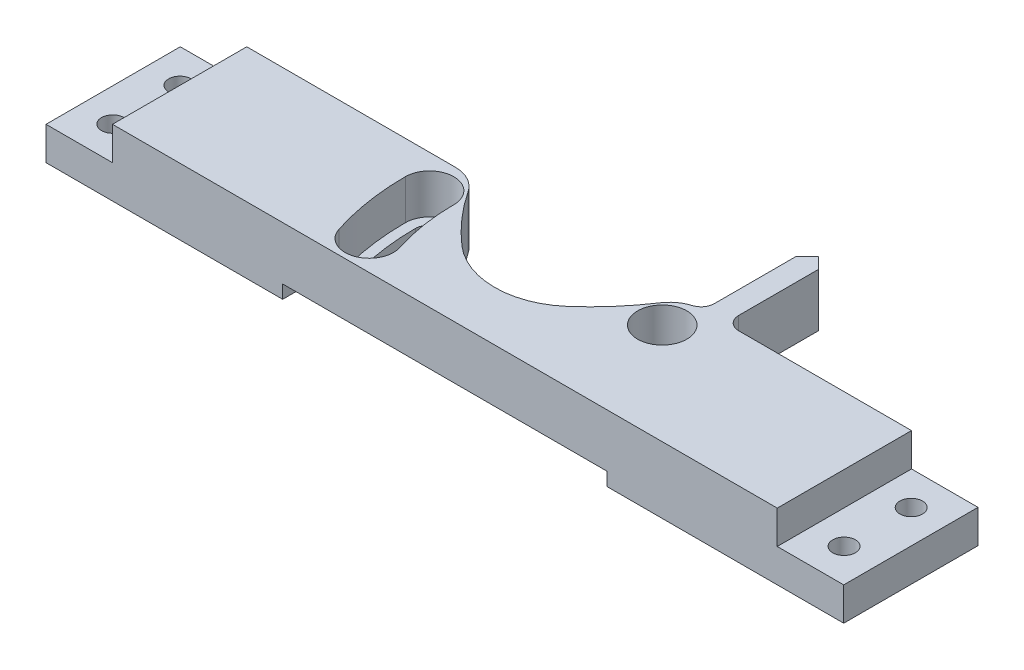
from build123d import *

# Parameters (mm, degrees)
AUFSATZ_LINEAR_AUSTRAGEN1_DEPTH  = 10
AUFSATZ_LINEAR_START             = 2
AUFSATZ_LINEAR_AUSTRAGEN2_DEPTH  = 2
SKIZZE3_R                        = 2.15
SCHNITT_LINEAR_AUSTRAGEN1_DEPTH  = 63.032572089
SKIZZE5_R                        = 3.7
SKIZZE5_R_2                      = 2.15
SCHNITT_LINEAR_AUSTRAGEN3_DEPTH  = 6
VERRUNDUNG3_START                = -11
VERRUNDUNG3_DEPTH                = 12
VERRUNDUNG3_START_2              = -10.2
VERRUNDUNG3_2_DEPTH              = 10.2
SKIZZE9_W                        = 10
SKIZZE9_H                        = 5
SCHNITT_LINEAR_AUSTRAGEN6_DEPTH  = 62.676900052
SKIZZE10_W                       = 10
SKIZZE10_H                       = 10
AUFSATZ_LINEAR_AUSTRAGEN3_DEPTH  = 5
AUFSATZ_LINEAR_AUSTRAGEN4_DEPTH  = 10
SKIZZE12_R                       = 1.7
SCHNITT_LINEAR_AUSTRAGEN7_DEPTH  = 62.262060037
SCHNITT_LINEAR_AUSTRAGEN8_DEPTH  = 63.032572089
SCHNITT_LINEAR_AUSTRAGEN10_DEPTH = 63.032572089
VERRUNDUNG6_R                    = 5
VERRUNDUNG7_R                    = 12
SCHNITT_LINEAR_AUSTRAGEN11_DEPTH = 6
SKIZZE19_W                       = 48.79312263
SKIZZE19_H                       = 28.151116142
SCHNITT_LINEAR_AUSTRAGEN12_DEPTH = 4
AUFSATZ_LINEAR_AUSTRAGEN6_DEPTH  = 8
VERRUNDUNG8_R                    = 2


with BuildPart() as part:
    # Skizze1 → Aufsatz-Linear austragen1 (new body)
    with BuildSketch(Plane(origin=(0, 0, 0), x_dir=(1, 0, 0), z_dir=(0, 1, 0))):
        with BuildLine():
            Line((-60, 0), (60, 0))
            Line((60, 0), (60, 10.2))
            Line((60, 10.2), (14.486956443, 10.2))
            ThreePointArc((14.486956443, 10.2), (7.840151577, 5.759336515), (0, 4.2))
            ThreePointArc((0, 4.2), (-7.840151577, 5.759336515), (-14.486956443, 10.2))
            Line((-14.486956443, 10.2), (-60, 10.2))
            Line((-60, 10.2), (-60, 0))
        make_face()
    extrude(amount=AUFSATZ_LINEAR_AUSTRAGEN1_DEPTH)

    # Skizze7 → Aufsatz-Linear austragen2 (add)
    with BuildSketch(Plane.XZ.offset(AUFSATZ_LINEAR_START)):
        with BuildLine():
            Line((23, 0), (23, -10.2))
            Line((23, -10.2), (14.486956443, -10.2))
            ThreePointArc((14.486956443, -10.2), (0, -4.2), (-14.486956443, -10.2))
            Line((-14.486956443, -10.2), (-23, -10.2))
            Line((-23, -10.2), (-23, 0))
            Line((-23, 0), (23, 0))
        make_face()
    extrude(amount=-AUFSATZ_LINEAR_AUSTRAGEN2_DEPTH)

    # Skizze3 → Schnitt-Linear austragen1 (cut, through all)
    with BuildSketch(Plane(origin=(0, 10, 0), x_dir=(1, 0, 0), z_dir=(0, 1, 0))):
        with Locations(Location((17.5, 5.2, 0), (0, 0, 270))):
            Circle(SKIZZE3_R)
    extrude(amount=-SCHNITT_LINEAR_AUSTRAGEN1_DEPTH, mode=Mode.SUBTRACT)

    # Skizze5 → Schnitt-Linear austragen3 (cut)
    with BuildSketch(Plane(origin=(0, 10, 0), x_dir=(1, 0, 0), z_dir=(0, 1, 0))):
        with Locations(Location((17.5, 5.2, 0), (0, 0, 270))):
            Circle(SKIZZE5_R)
        with Locations(Location((17.5, 5.2, 0), (0, 0, 270))):
            Circle(SKIZZE5_R_2, mode=Mode.SUBTRACT)
    extrude(amount=-SCHNITT_LINEAR_AUSTRAGEN3_DEPTH, mode=Mode.SUBTRACT)

    # Verrundung3: read off the stored shape, not the designer's step
    # Verrundung3 outline → Verrundung3 (cut)
    with BuildSketch(Plane.XY.offset(VERRUNDUNG3_START)):
        with BuildLine():
            ThreePointArc((23, -1), (22.707106781, -1.707106781), (22, -2))
            Line((22, -2), (23, -2))
            Line((23, -2), (23, -1))
        make_face()
        with BuildLine():
            ThreePointArc((-22, -2), (-22.707106781, -1.707106781), (-23, -1))
            Line((-23, -1), (-23, -2))
            Line((-23, -2), (-22, -2))
        make_face()
    extrude(amount=VERRUNDUNG3_DEPTH, mode=Mode.SUBTRACT)

    # Verrundung3 2 outline → Verrundung3 2 (add)
    with BuildSketch(Plane.XY.offset(VERRUNDUNG3_START_2)):
        with BuildLine():
            Line((-23, 0), (-24, 0))
            ThreePointArc((-24, 0), (-23.292893219, -0.292893219), (-23, -1))
            Line((-23, -1), (-23, 0))
        make_face()
        with BuildLine():
            Line((23, 0), (23, -1))
            ThreePointArc((23, -1), (23.292893219, -0.292893219), (24, 0))
            Line((24, 0), (23, 0))
        make_face()
    extrude(amount=VERRUNDUNG3_2_DEPTH)

    # Skizze9 → Schnitt-Linear austragen6 (cut, through all)
    with BuildSketch(Plane.XY):
        with Locations((-55, 7.5)):
            Rectangle(SKIZZE9_W, SKIZZE9_H)
        with Locations((55, 7.5)):
            Rectangle(SKIZZE9_W, SKIZZE9_H)
    extrude(amount=-SCHNITT_LINEAR_AUSTRAGEN6_DEPTH, mode=Mode.SUBTRACT)

    # Skizze10 → Aufsatz-Linear austragen3 (add)
    with BuildSketch(Plane.XZ):
        with Locations((-55, 5)):
            Rectangle(SKIZZE10_W, SKIZZE10_H)
        with Locations((55, 5)):
            Rectangle(SKIZZE10_W, SKIZZE10_H)
    extrude(amount=-AUFSATZ_LINEAR_AUSTRAGEN3_DEPTH)

    # Skizze11 → Aufsatz-Linear austragen4 (add)
    with BuildSketch(Plane.XY):
        with BuildLine():
            Line((-50, 10), (-50, 0))
            Line((-50, 0), (-24, 0))
            ThreePointArc((-24, 0), (-23.292893219, -0.292893219), (-23, -1))
            ThreePointArc((-23, -1), (-22.707106781, -1.707106781), (-22, -2))
            Line((-22, -2), (22, -2))
            ThreePointArc((22, -2), (22.707106781, -1.707106781), (23, -1))
            ThreePointArc((23, -1), (23.292893219, -0.292893219), (24, 0))
            Line((24, 0), (50, 0))
            Line((50, 0), (50, 10))
            Line((50, 10), (-50, 10))
        make_face()
    extrude(amount=AUFSATZ_LINEAR_AUSTRAGEN4_DEPTH)

    # Skizze12 → Schnitt-Linear austragen7 (cut, through all)
    with BuildSketch(Plane(origin=(0, 5, 0), x_dir=(1, 0, 0), z_dir=(0, 1, 0))):
        with Locations(Location((55, 5.15, 0), (0, 0, 270))):
            Circle(SKIZZE12_R)
        with Locations(Location((55, -4.95, 0), (0, 0, 270))):
            Circle(SKIZZE12_R)
        with Locations(Location((-55, -4.95, 0), (0, 0, 90))):
            Circle(SKIZZE12_R)
        with Locations(Location((-55, 5.15, 0), (0, 0, 90))):
            Circle(SKIZZE12_R)
    extrude(amount=-SCHNITT_LINEAR_AUSTRAGEN7_DEPTH, mode=Mode.SUBTRACT)

    # Skizze14 → Schnitt-Linear austragen8 (cut, through all)
    with BuildSketch(Plane.XZ.offset(2)):
        with BuildLine():
            ThreePointArc((-17.852169734, 6.216943335), (-19.197790162, 0.578814515), (-19.65, -5.2))
            ThreePointArc((-19.65, -5.2), (-17.5, -7.35), (-15.35, -5.2))
            ThreePointArc((-15.35, -5.2), (-14.950132082, -0.090065766), (-13.760263143, 4.895466718))
            ThreePointArc((-13.760263143, 4.895466718), (-15.145478129, 7.602158322), (-17.852169734, 6.216943335))
        make_face()
    extrude(amount=-SCHNITT_LINEAR_AUSTRAGEN8_DEPTH, mode=Mode.SUBTRACT)

    # Skizze15 → Schnitt-Linear austragen10 (cut, through all)
    with BuildSketch(Plane.XZ.offset(2)):
        with BuildLine():
            Line((15.834683057, -10.2), (10.771946853, -14.532947046))
            Line((10.771946853, -14.532947046), (0, -16.110649456))
            Line((0, -16.110649456), (-10.771946853, -14.532947046))
            Line((-10.771946853, -14.532947046), (-15.834683057, -10.2))
            ThreePointArc((-15.834683057, -10.2), (-9.044172408, -1.504818286), (0, 4.813422401))
            ThreePointArc((0, 4.813422401), (9.044172408, -1.504818286), (15.834683057, -10.2))
        make_face()
    extrude(amount=-SCHNITT_LINEAR_AUSTRAGEN10_DEPTH, mode=Mode.SUBTRACT)

    # Verrundung6
    verrundung6_edges = [part.edges().sort_by_distance(p)[0] for p in [
        (15.834683057, 4, -10.2),
        (-15.834683057, 4, -10.2),
    ]]
    fillet(verrundung6_edges, radius=VERRUNDUNG6_R)

    # Verrundung7
    verrundung7_edges = [part.edges().sort_by_distance(p)[0] for p in [
        (0, 4, 4.813422401),
    ]]
    fillet(verrundung7_edges, radius=VERRUNDUNG7_R)

    # Skizze16 → Schnitt-Linear austragen11 (cut)
    with BuildSketch(Plane(origin=(0, 10, 0), x_dir=(1, 0, 0), z_dir=(0, 1, 0))):
        with BuildLine():
            ThreePointArc((-21.15, 5.2), (-20.679531353, -0.812144845), (-19.27957901, -6.677923551))
            ThreePointArc((-19.27957901, -6.677923551), (-14.684497914, -9.029567598), (-12.332853867, -4.434486502))
            ThreePointArc((-12.332853867, -4.434486502), (-13.468390891, 0.323396096), (-13.85, 5.2))
            ThreePointArc((-13.85, 5.2), (-17.5, 8.85), (-21.15, 5.2))
        make_face()
    extrude(amount=-SCHNITT_LINEAR_AUSTRAGEN11_DEPTH, mode=Mode.SUBTRACT)

    # Skizze19 → Schnitt-Linear austragen12 (cut)
    with BuildSketch(Plane.XZ.offset(2)):
        Rectangle(SKIZZE19_W, SKIZZE19_H)
    extrude(amount=-SCHNITT_LINEAR_AUSTRAGEN12_DEPTH, mode=Mode.SUBTRACT)

    # Skizze18 → Aufsatz-Linear austragen6 (add)
    with BuildSketch(Plane.XZ.offset(-2)):
        Polygon((22, -10.2), (22, -24.207768556), (20.316248486, -25.89152007), (18.632496972, -24.207768556), (18.632496972, -10.2), align=None)
    extrude(amount=-AUFSATZ_LINEAR_AUSTRAGEN6_DEPTH)

    # Verrundung8
    verrundung8_edges = [part.edges().sort_by_distance(p)[0] for p in [
        (18.632496972, 6, -10.2),
        (22, 6, -10.2),
    ]]
    fillet(verrundung8_edges, radius=VERRUNDUNG8_R)


solid = part.part
